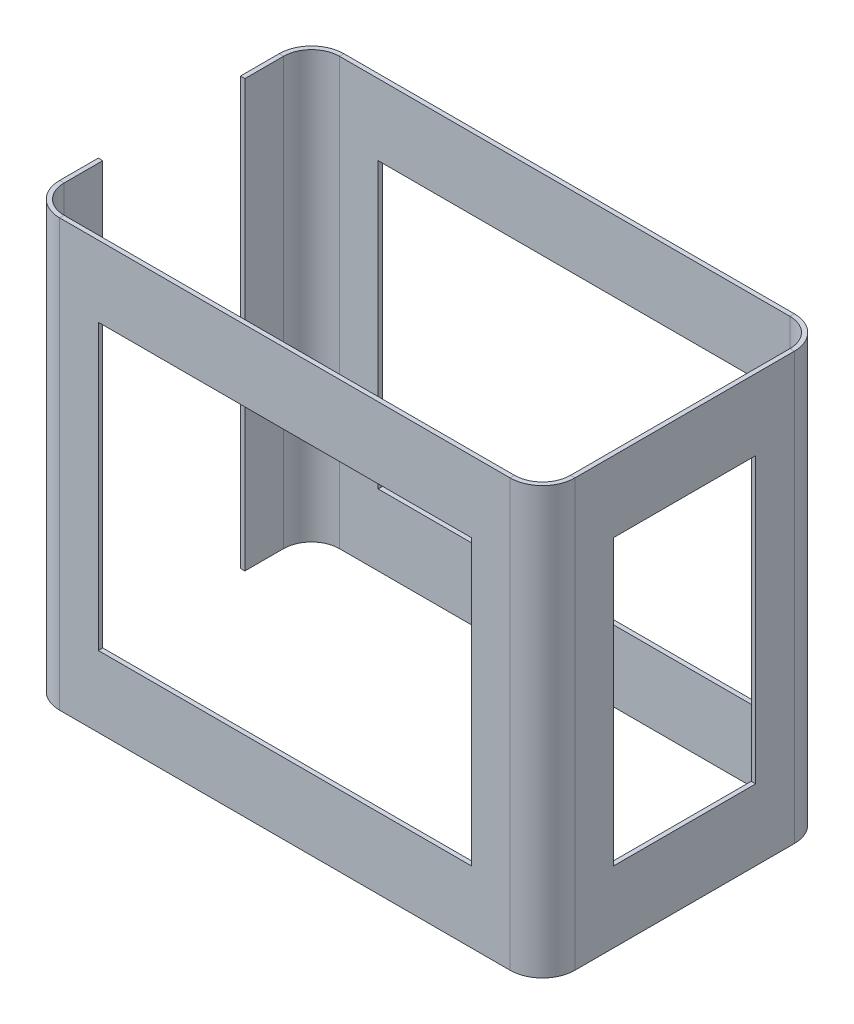
from build123d import *

# Parameters (mm, degrees)
SKETCH1_W                    = 184.15
SKETCH1_H                    = 152.4
SKETCH1_W_2                  = 133.35
SKETCH1_H_2                  = 101.6
BOSS_EXTRUDE1_DEPTH          = 1.5875
EDGE_FLANGE1_STRIP_W         = 26.35
EDGE_FLANGE1_STRIP_H         = 1.5875
EDGE_FLANGE1_STRIP_CUT_DEPTH = 152.4
EDGE_FLANGE1_DEPTH           = 152.4
EDGE_FLANGE2_STRIP_W         = 26.35
EDGE_FLANGE2_STRIP_H         = 1.5875
EDGE_FLANGE2_STRIP_CUT_DEPTH = 152.4
EDGE_FLANGE2_DEPTH           = 152.4
SKETCH16_W                   = 133.35
SKETCH16_H                   = 101.6
CUT_EXTRUDE1_DEPTH           = 1.5875
SKETCH17_W                   = 50.8
SKETCH17_H                   = 101.6
CUT_EXTRUDE2_DEPTH           = 1.5875
EDGE_FLANGE3_STRIP_W         = 26.35
EDGE_FLANGE3_STRIP_H         = 1.5875
EDGE_FLANGE3_STRIP_CUT_DEPTH = 152.4
EDGE_FLANGE3_DEPTH           = 152.4
EDGE_FLANGE4_STRIP_W         = 26.35
EDGE_FLANGE4_STRIP_H         = 1.5875
EDGE_FLANGE4_STRIP_CUT_DEPTH = 152.4
EDGE_FLANGE4_DEPTH           = 152.4


# Sheet-metal steps are written as plain solids
with BuildPart() as part:
    # Sketch1 → Boss-Extrude1 (new body)
    with BuildSketch(Plane.XY):
        with Locations((-92.075, 76.2)):
            Rectangle(SKETCH1_W, SKETCH1_H)
        with Locations((-92.075, 76.2)):
            Rectangle(SKETCH1_W_2, SKETCH1_H_2, mode=Mode.SUBTRACT)
    extrude(amount=BOSS_EXTRUDE1_DEPTH)

    # Edge-Flange1 strip (across the edge) → Edge-Flange1 strip cut (cut)
    with BuildSketch(Plane(origin=(0, 152.4, 0), x_dir=(-1, 0, 0), z_dir=(0, -1, 0))):
        with Locations((-1.5875, -0.79375)):
            Rectangle(EDGE_FLANGE1_STRIP_W, EDGE_FLANGE1_STRIP_H)
    extrude(amount=EDGE_FLANGE1_STRIP_CUT_DEPTH, mode=Mode.SUBTRACT)

    # Edge-Flange1 section (across the edge) → Edge-Flange1 (add)
    with BuildSketch(Plane(origin=(0, 152.4, 0), x_dir=(-1, 0, 0), z_dir=(0, -1, 0))):
        with BuildLine():
            Line((0, 10), (0, 100.0125))
            Line((0, 100.0125), (1.5875, 100.0125))
            Line((1.5875, 100.0125), (1.5875, 10))
            ThreePointArc((1.5875, 10), (4.516432188, 2.928932188), (11.5875, 0))
            Line((11.5875, 0), (11.5875, -1.5875))
            ThreePointArc((11.5875, -1.5875), (3.393900173, 1.806400173), (0, 10))
        make_face()
    extrude(amount=EDGE_FLANGE1_DEPTH)

    # Edge-Flange2 strip (across the edge) → Edge-Flange2 strip cut (cut)
    with BuildSketch(Plane(origin=(-1.5875, 152.4, -100.0125), x_dir=(0, 0, 1), z_dir=(0, -1, 0))):
        with Locations((-1.5875, -0.79375)):
            Rectangle(EDGE_FLANGE2_STRIP_W, EDGE_FLANGE2_STRIP_H)
    extrude(amount=EDGE_FLANGE2_STRIP_CUT_DEPTH, mode=Mode.SUBTRACT)

    # Edge-Flange2 section (across the edge) → Edge-Flange2 (add)
    with BuildSketch(Plane(origin=(-1.5875, 152.4, -100.0125), x_dir=(0, 0, 1), z_dir=(0, -1, 0))):
        with BuildLine():
            Line((0, 10), (0, 182.5625))
            Line((0, 182.5625), (1.5875, 182.5625))
            Line((1.5875, 182.5625), (1.5875, 10))
            ThreePointArc((1.5875, 10), (4.516432188, 2.928932188), (11.5875, 0))
            Line((11.5875, 0), (11.5875, -1.5875))
            ThreePointArc((11.5875, -1.5875), (3.393900173, 1.806400173), (0, 10))
        make_face()
    extrude(amount=EDGE_FLANGE2_DEPTH)

    # Sketch16 → Cut-Extrude1 (cut)
    with BuildSketch(Plane(origin=(0, 0, -100.0125), x_dir=(-1, 0, 0), z_dir=(0, 0, -1))):
        with Locations((92.075, 76.2)):
            Rectangle(SKETCH16_W, SKETCH16_H)
    extrude(amount=-CUT_EXTRUDE1_DEPTH, mode=Mode.SUBTRACT)

    # Sketch17 → Cut-Extrude2 (cut)
    with BuildSketch(Plane.ZY.offset(1.5875)):
        with Locations((-49.2125, 76.2)):
            Rectangle(SKETCH17_W, SKETCH17_H)
    extrude(amount=-CUT_EXTRUDE2_DEPTH, mode=Mode.SUBTRACT)

    # Edge-Flange3 strip (across the edge) → Edge-Flange3 strip cut (cut)
    with BuildSketch(Plane(origin=(-184.15, 152.4, -98.425), x_dir=(1, 0, 0), z_dir=(0, -1, 0))):
        with Locations((-1.5875, -0.79375)):
            Rectangle(EDGE_FLANGE3_STRIP_W, EDGE_FLANGE3_STRIP_H)
    extrude(amount=EDGE_FLANGE3_STRIP_CUT_DEPTH, mode=Mode.SUBTRACT)

    # Edge-Flange3 section (across the edge) → Edge-Flange3 (add)
    with BuildSketch(Plane(origin=(-184.15, 152.4, -98.425), x_dir=(1, 0, 0), z_dir=(0, -1, 0))):
        with BuildLine():
            Line((0, 10), (0, 23.8125))
            Line((0, 23.8125), (1.5875, 23.8125))
            Line((1.5875, 23.8125), (1.5875, 10))
            ThreePointArc((1.5875, 10), (4.516432188, 2.928932188), (11.5875, 0))
            Line((11.5875, 0), (11.5875, -1.5875))
            ThreePointArc((11.5875, -1.5875), (3.393900173, 1.806400173), (0, 10))
        make_face()
    extrude(amount=EDGE_FLANGE3_DEPTH)

    # Edge-Flange4 strip (across the edge) → Edge-Flange4 strip cut (cut)
    with BuildSketch(Plane(origin=(-184.15, 0, 0), x_dir=(1, 0, 0), z_dir=(0, 1, 0))):
        with Locations((-1.5875, -0.79375)):
            Rectangle(EDGE_FLANGE4_STRIP_W, EDGE_FLANGE4_STRIP_H)
    extrude(amount=EDGE_FLANGE4_STRIP_CUT_DEPTH, mode=Mode.SUBTRACT)

    # Edge-Flange4 section (across the edge) → Edge-Flange4 (add)
    with BuildSketch(Plane(origin=(-184.15, 0, 0), x_dir=(1, 0, 0), z_dir=(0, 1, 0))):
        with BuildLine():
            Line((0, 10), (0, 23.8125))
            Line((0, 23.8125), (1.5875, 23.8125))
            Line((1.5875, 23.8125), (1.5875, 10))
            ThreePointArc((1.5875, 10), (4.516432188, 2.928932188), (11.5875, 0))
            Line((11.5875, 0), (11.5875, -1.5875))
            ThreePointArc((11.5875, -1.5875), (3.393900173, 1.806400173), (0, 10))
        make_face()
    extrude(amount=EDGE_FLANGE4_DEPTH)


solid = part.part
